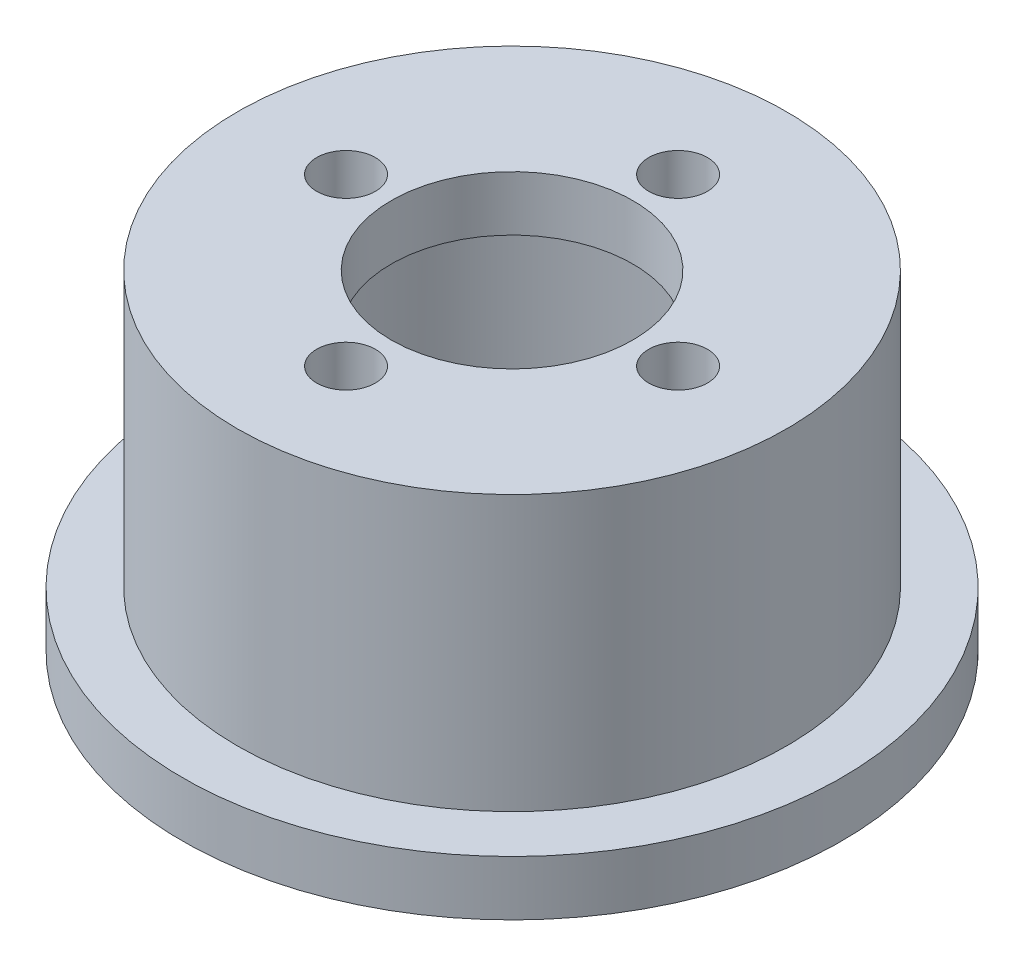
from build123d import *

# Parameters (mm, degrees)
SKETCH1_R           = 25
SKETCH1_R_2         = 20
BOSS_EXTRUDE1_DEPTH = 20
SKETCH2_R           = 25
SKETCH2_R_2         = 11
BOSS_EXTRUDE2_DEPTH = 5
BOSS_EXTRUDE3_START = 5
SKETCH4_R           = 30
SKETCH4_R_2         = 20
BOSS_EXTRUDE3_DEPTH = 5
SKETCH8_R           = 2.672153823
CUT_EXTRUDE2_DEPTH  = 10


with BuildPart() as part:
    # Sketch1 → Boss-Extrude1 (new body)
    with BuildSketch(Plane(origin=(0, 0, 0), x_dir=(1, 0, 0), z_dir=(0, 1, 0))):
        Circle(SKETCH1_R)
        Circle(SKETCH1_R_2, mode=Mode.SUBTRACT)
    extrude(amount=BOSS_EXTRUDE1_DEPTH)

    # Sketch2 → Boss-Extrude2 (add)
    with BuildSketch(Plane(origin=(0, 20, 0), x_dir=(1, 0, 0), z_dir=(0, 1, 0))):
        Circle(SKETCH2_R)
        Circle(SKETCH2_R_2, mode=Mode.SUBTRACT)
    extrude(amount=BOSS_EXTRUDE2_DEPTH)

    # Sketch4 → Boss-Extrude3 (add)
    with BuildSketch(Plane(origin=(0, 0, 0), x_dir=(-1, 0, 0), z_dir=(0, -1, 0)).offset(BOSS_EXTRUDE3_START)):
        Circle(SKETCH4_R)
        Circle(SKETCH4_R_2, mode=Mode.SUBTRACT)
    extrude(amount=-BOSS_EXTRUDE3_DEPTH)

    # Sketch8 → Cut-Extrude2 (cut)
    with BuildSketch(Plane(origin=(0, 20, 0), x_dir=(1, 0, 0), z_dir=(0, 1, 0))):
        with Locations((0, -15.113195661)):
            Circle(SKETCH8_R)
        with Locations((-15.113195661, 0)):
            Circle(SKETCH8_R)
        with Locations((0, 15.113195661)):
            Circle(SKETCH8_R)
        with Locations((15.113195661, 0)):
            Circle(SKETCH8_R)
    extrude(amount=CUT_EXTRUDE2_DEPTH, mode=Mode.SUBTRACT)


solid = part.part
